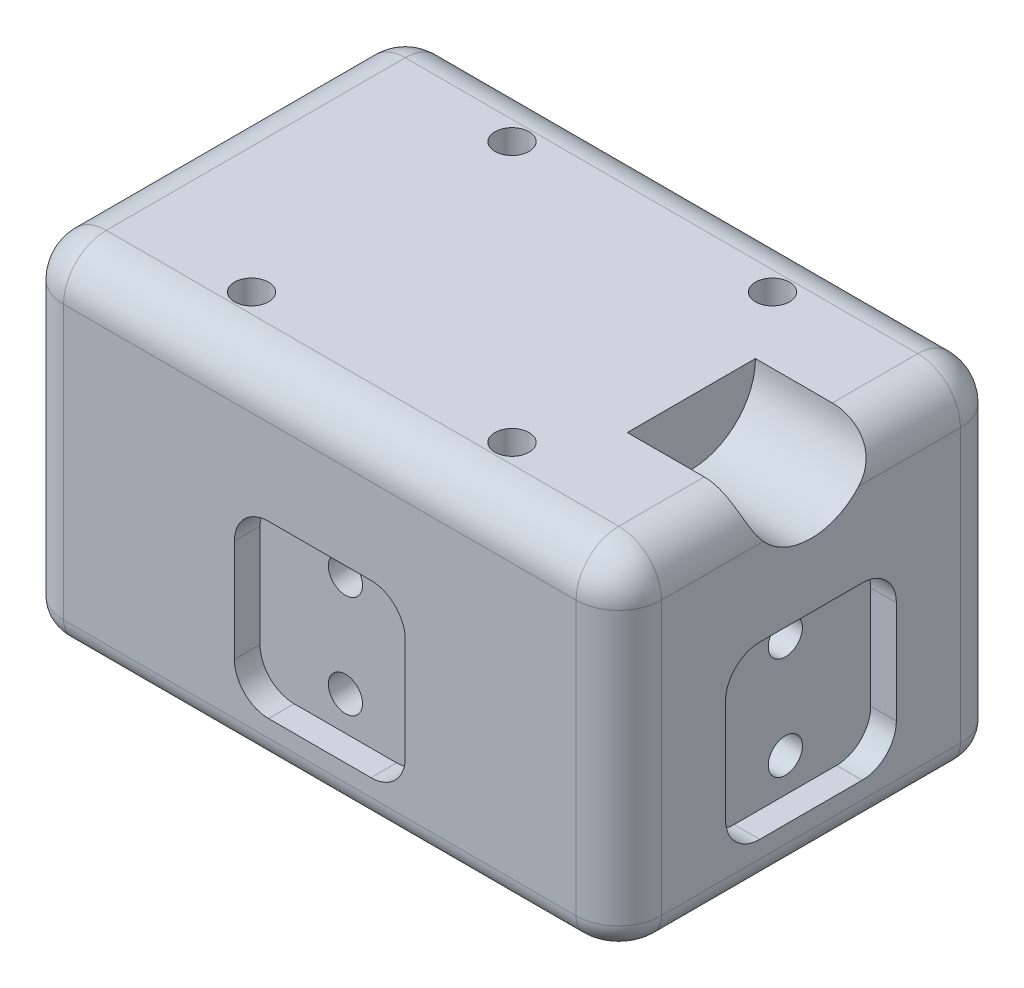
from build123d import *

# Parameters (mm, degrees)
SKETCH1_W           = 70
SKETCH1_H           = 45
BOSS_EXTRUDE1_DEPTH = 40
SKETCH2_R           = 2
CUT_EXTRUDE1_DEPTH  = 10
CUT_EXTRUDE2_DEPTH  = 3
SKETCH4_R           = 2
CUT_EXTRUDE3_DEPTH  = 10
CUT_EXTRUDE4_DEPTH  = 3
SKETCH8_R           = 2
CUT_EXTRUDE5_DEPTH  = 10
FILLET1_R           = 3
FILLET2_R           = 5
SKETCH9_W           = 31
SKETCH9_H           = 7
CUT_EXTRUDE6_DEPTH  = 55
SKETCH10_R          = 2
CUT_EXTRUDE7_DEPTH  = 6
SKETCH11_R          = 7.5
CUT_EXTRUDE8_DEPTH  = 14
FILLET3_R           = 5


with BuildPart() as part:
    # Sketch1 → Boss-Extrude1 (new body)
    with BuildSketch(Plane(origin=(0, 0, 0), x_dir=(1, 0, 0), z_dir=(0, 1, 0))):
        Rectangle(SKETCH1_W, SKETCH1_H)
    extrude(amount=BOSS_EXTRUDE1_DEPTH)

    # Sketch2 → Cut-Extrude1 (cut)
    with BuildSketch(Plane.XZ):
        with Locations(Location((-28, 15.5, 0), (0, 0, 270))):
            Circle(SKETCH2_R)
        with Locations(Location((28, 15.5, 0), (0, 0, 90))):
            Circle(SKETCH2_R)
        with Locations(Location((28, -16.330849274, 0), (0, 0, 270))):
            Circle(SKETCH2_R)
        with Locations(Location((-28, -16.330849274, 0), (0, 0, 90))):
            Circle(SKETCH2_R)
    extrude(amount=-CUT_EXTRUDE1_DEPTH, mode=Mode.SUBTRACT)

    # Sketch3 → Cut-Extrude2 (cut)
    with BuildSketch(Plane(origin=(35, 0, 0), x_dir=(0, 0, -1), z_dir=(1, 0, 0))):
        with BuildLine():
            Line((-6, 5), (6, 5))
            ThreePointArc((6, 5), (8.828427125, 6.171572875), (10, 9))
            Line((10, 9), (10, 21))
            ThreePointArc((10, 21), (8.828427125, 23.828427125), (6, 25))
            Line((6, 25), (-6, 25))
            ThreePointArc((-6, 25), (-8.828427125, 23.828427125), (-10, 21))
            Line((-10, 21), (-10, 9))
            ThreePointArc((-10, 9), (-8.828427125, 6.171572875), (-6, 5))
        make_face()
    cut_extrude2 = extrude(amount=-CUT_EXTRUDE2_DEPTH, mode=Mode.SUBTRACT)

    # Sketch4 → Cut-Extrude3 (cut)
    with BuildSketch(Plane(origin=(32, 0, 0), x_dir=(0, 0, -1), z_dir=(1, 0, 0))):
        with Locations((0, 21)):
            Circle(SKETCH4_R)
        with Locations((0, 9)):
            Circle(SKETCH4_R)
    cut_extrude3 = extrude(amount=-CUT_EXTRUDE3_DEPTH, mode=Mode.SUBTRACT)

    # Mirror1: Cut-Extrude2, Cut-Extrude3 across plane
    add(cut_extrude2.mirror(Plane(origin=(0, 0, 0), x_dir=(0, 0, 1), z_dir=(1, 0, 0))), mode=Mode.SUBTRACT)
    add(cut_extrude3.mirror(Plane(origin=(0, 0, 0), x_dir=(0, 0, 1), z_dir=(1, 0, 0))), mode=Mode.SUBTRACT)

    # Sketch7 → Cut-Extrude4 (cut)
    with BuildSketch(Plane(origin=(0, 0, -22.5), x_dir=(-1, 0, 0), z_dir=(0, 0, -1))):
        with BuildLine():
            Line((-6, 5), (6, 5))
            ThreePointArc((6, 5), (8.828427125, 6.171572875), (10, 9))
            Line((10, 9), (10, 21))
            ThreePointArc((10, 21), (8.828427125, 23.828427125), (6, 25))
            Line((6, 25), (-6, 25))
            ThreePointArc((-6, 25), (-8.828427125, 23.828427125), (-10, 21))
            Line((-10, 21), (-10, 9))
            ThreePointArc((-10, 9), (-8.828427125, 6.171572875), (-6, 5))
        make_face()
    cut_extrude4 = extrude(amount=-CUT_EXTRUDE4_DEPTH, mode=Mode.SUBTRACT)

    # Sketch8 → Cut-Extrude5 (cut)
    with BuildSketch(Plane(origin=(0, 0, -19.5), x_dir=(-1, 0, 0), z_dir=(0, 0, -1))):
        with Locations((0, 21)):
            Circle(SKETCH8_R)
        with Locations((0, 9)):
            Circle(SKETCH8_R)
    cut_extrude5 = extrude(amount=-CUT_EXTRUDE5_DEPTH, mode=Mode.SUBTRACT)

    # Mirror2: Cut-Extrude4, Cut-Extrude5 across plane
    add(cut_extrude4.mirror(Plane.XY), mode=Mode.SUBTRACT)
    add(cut_extrude5.mirror(Plane.XY), mode=Mode.SUBTRACT)

    # Fillet1
    fillet1_edges = [part.edges().sort_by_distance(p)[0] for p in [
        (-35, 0, 0),
        (0, 0, -22.5),
        (35, 0, 0),
        (0, 0, 22.5),
    ]]
    fillet(fillet1_edges, radius=FILLET1_R)

    # Fillet2
    # the kernel refuses this fillet: 5 mm, written as the material it takes off along each edge
    with BuildSketch(Plane(origin=(-30, 0, 17.5), x_dir=(0, 0, 1), z_dir=(1, 0, 0))) as fillet2_piece_1:
        with BuildLine():
            CenterArc((2, -3), 3, 0, 90)
            Line((5, -3), (5, 0))
            Line((5, 0), (2, 0))
        make_face()
    revolve(axis=Axis((-30, 0, 17.5), (0, -1, 0)), revolution_arc=90, mode=Mode.SUBTRACT)
    with BuildSketch(Plane(origin=(-30, 0, -17.5), x_dir=(-1, 0, 0), z_dir=(0, 0, 1))) as fillet2_piece_2:
        with BuildLine():
            CenterArc((2, -3), 3, 0, 90)
            Line((5, -3), (5, 0))
            Line((5, 0), (2, 0))
        make_face()
    revolve(axis=Axis((-30, 0, -17.5), (0, -1, 0)), revolution_arc=90, mode=Mode.SUBTRACT)
    with BuildSketch(Plane(origin=(30, 0, 17.5), x_dir=(1, 0, 0), z_dir=(0, 0, -1))) as fillet2_piece_3:
        with BuildLine():
            CenterArc((2, -3), 3, 0, 90)
            Line((5, -3), (5, 0))
            Line((5, 0), (2, 0))
        make_face()
    revolve(axis=Axis((30, 0, 17.5), (0, -1, 0)), revolution_arc=90, mode=Mode.SUBTRACT)
    with BuildSketch(Plane(origin=(30, 0, -17.5), x_dir=(0, 0, -1), z_dir=(-1, 0, 0))) as fillet2_piece_4:
        with BuildLine():
            CenterArc((2, -3), 3, 0, 90)
            Line((5, -3), (5, 0))
            Line((5, 0), (2, 0))
        make_face()
    revolve(axis=Axis((30, 0, -17.5), (0, -1, 0)), revolution_arc=90, mode=Mode.SUBTRACT)
    with BuildSketch(Plane(origin=(-35, 0, 22.5), x_dir=(1, 0, 0), z_dir=(0, 1, 0)), Plane(origin=(-35, 0, -22.5), x_dir=(0, 0, 1), z_dir=(0, 1, 0))) as fillet2_piece_5:
        with BuildLine():
            CenterArc((FILLET2_R, FILLET2_R), FILLET2_R, 180, 90)
            Line((0, FILLET2_R), (0, 0))
            Line((0, 0), (FILLET2_R, 0))
        make_face()
    extrude(amount=52.5, mode=Mode.SUBTRACT)
    with BuildSketch(Plane(origin=(35, 0, -22.5), x_dir=(0, 0, 1), z_dir=(0, 1, 0)), Plane(origin=(35, 0, 22.5), x_dir=(-1, 0, 0), z_dir=(0, 1, 0))) as fillet2_piece_6:
        with BuildLine():
            CenterArc((FILLET2_R, -FILLET2_R), FILLET2_R, 90, 90)
            Line((0, -FILLET2_R), (0, 0))
            Line((0, 0), (FILLET2_R, 0))
        make_face()
    extrude(amount=52.5, mode=Mode.SUBTRACT)

    # Sketch9 → Cut-Extrude6 (cut)
    with BuildSketch(Plane.ZY.offset(35)):
        with Locations((0, 32)):
            Rectangle(SKETCH9_W, SKETCH9_H)
    extrude(amount=-CUT_EXTRUDE6_DEPTH, mode=Mode.SUBTRACT)

    # Sketch10 → Cut-Extrude7 (cut)
    with BuildSketch(Plane(origin=(0, 40, 0), x_dir=(1, 0, 0), z_dir=(0, 1, 0))):
        with Locations(Location((15.25, 15.25, 0), (0, 0, 270))):
            Circle(SKETCH10_R)
        with Locations(Location((15.25, -15.25, 0), (0, 0, 270))):
            Circle(SKETCH10_R)
        with Locations(Location((-15.25, 15.25, 0), (0, 0, 270))):
            Circle(SKETCH10_R)
        with Locations(Location((-15.25, -15.25, 0), (0, 0, 270))):
            Circle(SKETCH10_R)
    extrude(amount=-CUT_EXTRUDE7_DEPTH, mode=Mode.SUBTRACT)

    # Sketch11 → Cut-Extrude8 (cut)
    with BuildSketch(Plane(origin=(35, 0, 0), x_dir=(0, 0, -1), z_dir=(1, 0, 0))):
        with Locations((0, 40)):
            Circle(SKETCH11_R)
    extrude(amount=-CUT_EXTRUDE8_DEPTH, mode=Mode.SUBTRACT)

    # Fillet3
    # the kernel refuses this fillet: 5 mm, written as the material it takes off along each edge
    with BuildSketch(Plane(origin=(35, 40, 5), x_dir=(-1, 0, 0), z_dir=(0, 0, -1)), Plane(origin=(35, 40, 17.5), x_dir=(-1, 0, 0), z_dir=(0, 0, -1))) as fillet3_piece_1:
        with BuildLine():
            CenterArc((FILLET3_R, -FILLET3_R), FILLET3_R, 90, 90)
            Line((0, -FILLET3_R), (0, 0))
            Line((0, 0), (FILLET3_R, 0))
        make_face()
    extrude(amount=22.5, mode=Mode.SUBTRACT)
    with BuildSketch(Plane(origin=(30, 40, -17.5), x_dir=(0, 0, -1), z_dir=(-1, 0, 0))) as fillet3_piece_2:
        with BuildLine():
            CenterArc((5 - FILLET3_R, FILLET3_R), FILLET3_R, 270, 90)
            Line((5, FILLET3_R), (5, 0))
            Line((5, 0), (5 - FILLET3_R, 0))
        make_face()
    revolve(axis=Axis((30, 40, -17.5), (0, -1, 0)), revolution_arc=90, mode=Mode.SUBTRACT)
    with BuildSketch(Plane(origin=(30, 40, -22.5), x_dir=(0, 0, 1), z_dir=(-1, 0, 0))) as fillet3_piece_3:
        with BuildLine():
            CenterArc((FILLET3_R, -FILLET3_R), FILLET3_R, 90, 90)
            Line((0, -FILLET3_R), (0, 0))
            Line((0, 0), (FILLET3_R, 0))
        make_face()
    extrude(amount=60, mode=Mode.SUBTRACT)
    with BuildSketch(Plane(origin=(-30, 40, -17.5), x_dir=(-1, 0, 0), z_dir=(0, 0, 1))) as fillet3_piece_4:
        with BuildLine():
            CenterArc((5 - FILLET3_R, FILLET3_R), FILLET3_R, 270, 90)
            Line((5, FILLET3_R), (5, 0))
            Line((5, 0), (5 - FILLET3_R, 0))
        make_face()
    revolve(axis=Axis((-30, 40, -17.5), (0, -1, 0)), revolution_arc=90, mode=Mode.SUBTRACT)
    with BuildSketch(Plane(origin=(-35, 40, -17.5), x_dir=(1, 0, 0), z_dir=(0, 0, 1))) as fillet3_piece_5:
        with BuildLine():
            CenterArc((FILLET3_R, -FILLET3_R), FILLET3_R, 90, 90)
            Line((0, -FILLET3_R), (0, 0))
            Line((0, 0), (FILLET3_R, 0))
        make_face()
    extrude(amount=35, mode=Mode.SUBTRACT)
    with BuildSketch(Plane(origin=(-30, 40, 17.5), x_dir=(0, 0, 1), z_dir=(1, 0, 0))) as fillet3_piece_6:
        with BuildLine():
            CenterArc((5 - FILLET3_R, FILLET3_R), FILLET3_R, 270, 90)
            Line((5, FILLET3_R), (5, 0))
            Line((5, 0), (5 - FILLET3_R, 0))
        make_face()
    revolve(axis=Axis((-30, 40, 17.5), (0, -1, 0)), revolution_arc=90, mode=Mode.SUBTRACT)
    with BuildSketch(Plane(origin=(30, 40, 17.5), x_dir=(1, 0, 0), z_dir=(0, 0, -1))) as fillet3_piece_7:
        with BuildLine():
            CenterArc((5 - FILLET3_R, FILLET3_R), FILLET3_R, 270, 90)
            Line((5 - FILLET3_R, 0), (5, 0))
            Line((5, 0), (5, FILLET3_R))
        make_face()
    revolve(axis=Axis((30, 40, 17.5), (0, -1, 0)), revolution_arc=90, mode=Mode.SUBTRACT)
    with BuildSketch(Plane(origin=(-30, 40, 22.5), x_dir=(0, -1, 0), z_dir=(1, 0, 0))) as fillet3_piece_8:
        with BuildLine():
            CenterArc((FILLET3_R, FILLET3_R), FILLET3_R, 180, 90)
            Line((0, FILLET3_R), (0, 0))
            Line((0, 0), (FILLET3_R, 0))
        make_face()
    extrude(amount=60, mode=Mode.SUBTRACT)


solid = part.part
